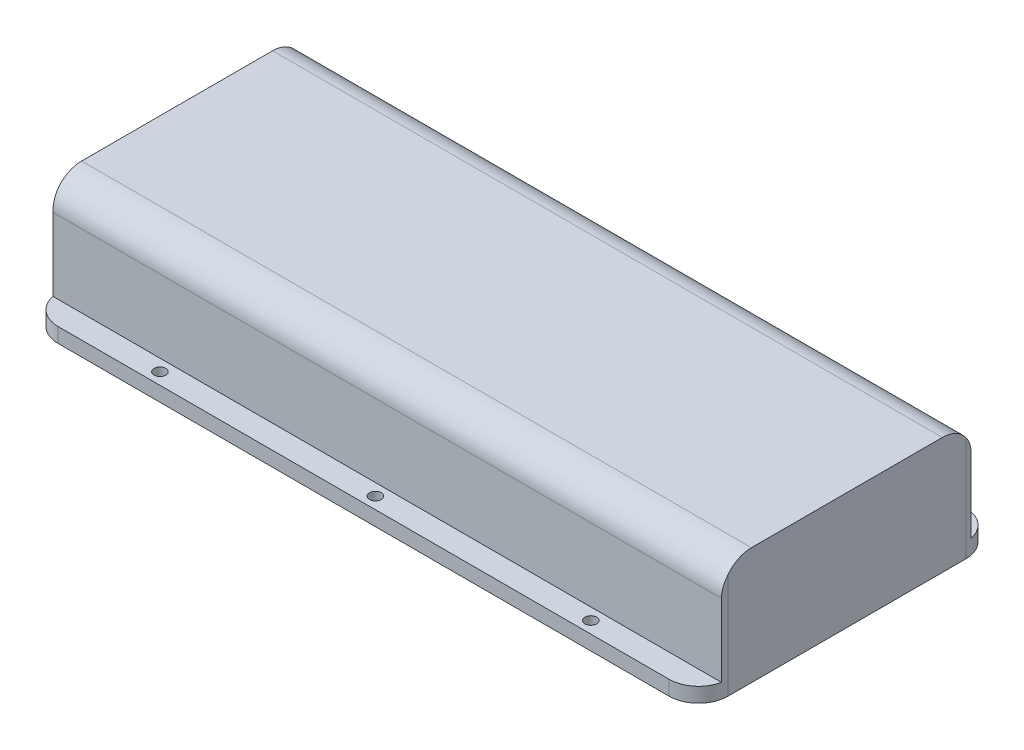
from build123d import *

# Parameters (mm, degrees)
SKETCH1_W           = 228
SKETCH1_H           = 101
BOSS_EXTRUDE1_DEPTH = 5
SKETCH2_R           = 2
CUT_EXTRUDE1_DEPTH  = 250.419325635
SKETCH3_W           = 228
SKETCH3_H           = 85
BOSS_EXTRUDE2_DEPTH = 34.8
SKETCH4_W           = 19.026867748
SKETCH4_H           = 7.567504218
BOSS_EXTRUDE3_DEPTH = 2.2
FILLET1_R           = 10


with BuildPart() as part:
    # Sketch1 → Boss-Extrude1 (new body)
    with BuildSketch(Plane(origin=(0, 0, 0), x_dir=(1, 0, 0), z_dir=(0, 1, 0))):
        with Locations((114, 50.5)):
            Rectangle(SKETCH1_W, SKETCH1_H)
    extrude(amount=BOSS_EXTRUDE1_DEPTH)

    # Sketch2 → Cut-Extrude1 (cut, through all)
    with BuildSketch(Plane(origin=(0, 5, 0), x_dir=(1, 0, 0), z_dir=(0, 1, 0))):
        with Locations((187.34, 97)):
            Circle(SKETCH2_R)
        with Locations((187.34, 4)):
            Circle(SKETCH2_R)
        with Locations((114, 97)):
            Circle(SKETCH2_R)
        with Locations((40.66, 97)):
            Circle(SKETCH2_R)
        with Locations((114, 4)):
            Circle(SKETCH2_R)
        with Locations((40.66, 4)):
            Circle(SKETCH2_R)
    extrude(amount=-CUT_EXTRUDE1_DEPTH, mode=Mode.SUBTRACT)

    # Sketch3 → Boss-Extrude2 (add)
    with BuildSketch(Plane(origin=(0, 5, 0), x_dir=(1, 0, 0), z_dir=(0, 1, 0))):
        with Locations((114, 50.5)):
            Rectangle(SKETCH3_W, SKETCH3_H)
    extrude(amount=BOSS_EXTRUDE2_DEPTH)

    # Sketch4 → Boss-Extrude3 (add)
    with BuildSketch(Plane.ZY):
        with Locations((-40.824405321, 21.683781351)):
            Rectangle(SKETCH4_W, SKETCH4_H)
    extrude(amount=BOSS_EXTRUDE3_DEPTH)

    # Fillet1
    fillet1_edges = [part.edges().sort_by_distance(p)[0] for p in [
        (0, 2.5, 0),
    ]]
    fillet(fillet1_edges, radius=FILLET1_R)
    fillet1_2_edges = [part.edges().sort_by_distance(p)[0] for p in [
        (228, 2.5, 0),
    ]]
    fillet(fillet1_2_edges, radius=FILLET1_R)
    fillet1_3_edges = [part.edges().sort_by_distance(p)[0] for p in [
        (0, 2.5, -101),
    ]]
    fillet(fillet1_3_edges, radius=FILLET1_R)
    fillet1_4_edges = [part.edges().sort_by_distance(p)[0] for p in [
        (228, 2.5, -101),
    ]]
    fillet(fillet1_4_edges, radius=FILLET1_R)
    fillet1_5_edges = [part.edges().sort_by_distance(p)[0] for p in [
        (114, 39.8, -93),
    ]]
    fillet(fillet1_5_edges, radius=FILLET1_R)
    fillet1_6_edges = [part.edges().sort_by_distance(p)[0] for p in [
        (114, 39.8, -8),
    ]]
    fillet(fillet1_6_edges, radius=FILLET1_R)


solid = part.part
